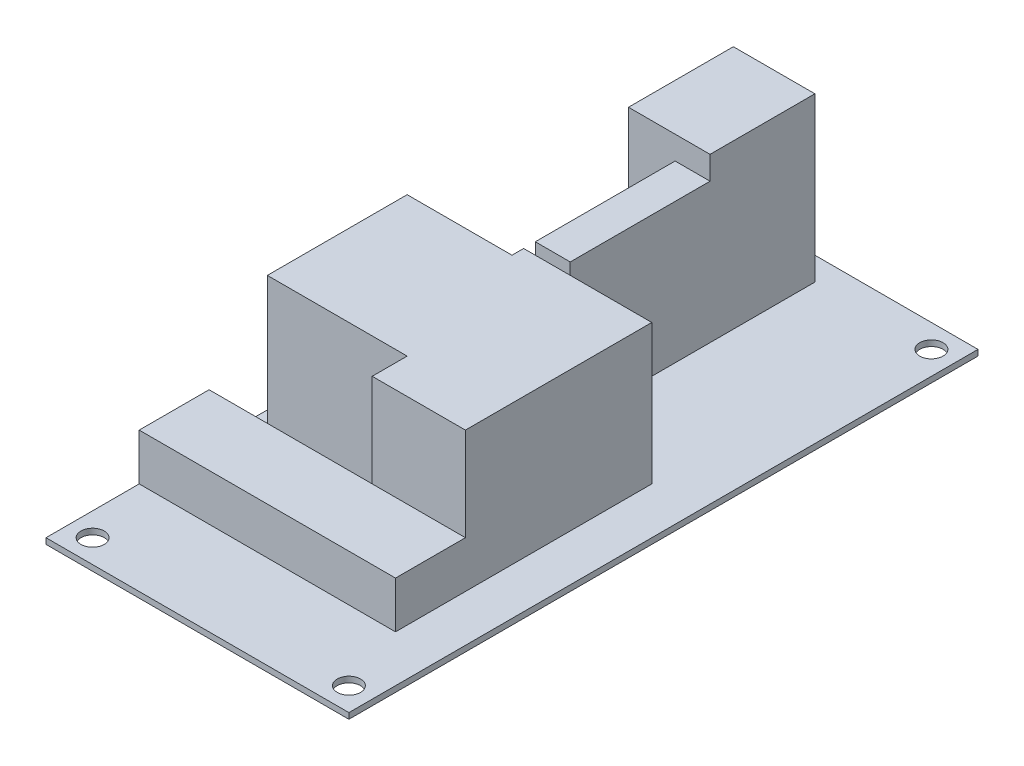
from build123d import *

# Parameters (mm, degrees)
SKETCH1_W           = 41.275
SKETCH1_H           = 85.725
BOSS_EXTRUDE1_DEPTH = 0.79375
SKETCH2_W           = 34.925
SKETCH2_H           = 9.525
BOSS_EXTRUDE2_DEPTH = 6.35
BOSS_EXTRUDE3_DEPTH = 19.05
SKETCH4_W           = 11.1125
SKETCH4_H           = 11.1125
BOSS_EXTRUDE4_DEPTH = 6.35
SKETCH5_R           = 2.38125
BOSS_EXTRUDE5_DEPTH = 3.175
SKETCH6_W           = 4.7625
SKETCH6_H           = 19.05
BOSS_EXTRUDE6_DEPTH = 19.05
SKETCH7_W           = 11.1125
SKETCH7_H           = 14.2875
BOSS_EXTRUDE7_DEPTH = 22.225
SKETCH8_R           = 1.5875
CUT_EXTRUDE1_DEPTH  = 53.507627422


with BuildPart() as part:
    # Sketch1 → Boss-Extrude1 (new body)
    with BuildSketch(Plane(origin=(0, 0, 0), x_dir=(1, 0, 0), z_dir=(0, 1, 0))):
        Rectangle(SKETCH1_W, SKETCH1_H)
    extrude(amount=BOSS_EXTRUDE1_DEPTH)

    # Sketch2 → Boss-Extrude2 (add)
    with BuildSketch(Plane(origin=(0, 0.79375, 0), x_dir=(1, 0, 0), z_dir=(0, 1, 0))):
        with Locations((-3.175, -25.4)):
            Rectangle(SKETCH2_W, SKETCH2_H)
    extrude(amount=BOSS_EXTRUDE2_DEPTH)

    # Sketch3 → Boss-Extrude3 (add)
    with BuildSketch(Plane(origin=(0, 0.79375, 0), x_dir=(1, 0, 0), z_dir=(0, 1, 0))):
        Polygon((14.2875, -20.6375), (14.2875, 4.7625), (-3.175, 4.7625), (-3.175, 3.175), (-17.4625, 3.175), (-17.4625, -15.875), (1.5875, -15.875), (1.5875, -20.6375), align=None)
    extrude(amount=BOSS_EXTRUDE3_DEPTH)

    # Sketch4 → Boss-Extrude4 (add)
    with BuildSketch(Plane(origin=(0, 0.79375, 0), x_dir=(1, 0, 0), z_dir=(0, 1, 0))):
        with Locations((-8.73125, 15.08125)):
            Rectangle(SKETCH4_W, SKETCH4_H)
    extrude(amount=BOSS_EXTRUDE4_DEPTH)

    # Sketch5 → Boss-Extrude5 (add)
    with BuildSketch(Plane(origin=(0, 7.14375, 0), x_dir=(1, 0, 0), z_dir=(0, 1, 0))):
        with Locations((-8.73125, 15.08125)):
            Circle(SKETCH5_R)
    extrude(amount=BOSS_EXTRUDE5_DEPTH)

    # Sketch6 → Boss-Extrude6 (add)
    with BuildSketch(Plane(origin=(0, 0.79375, 0), x_dir=(1, 0, 0), z_dir=(0, 1, 0))):
        with Locations((-0.79375, 15.875)):
            Rectangle(SKETCH6_W, SKETCH6_H)
    extrude(amount=BOSS_EXTRUDE6_DEPTH)

    # Sketch7 → Boss-Extrude7 (add)
    with BuildSketch(Plane(origin=(0, 0.79375, 0), x_dir=(1, 0, 0), z_dir=(0, 1, 0))):
        with Locations((-3.96875, 32.54375)):
            Rectangle(SKETCH7_W, SKETCH7_H)
    extrude(amount=BOSS_EXTRUDE7_DEPTH)

    # Sketch8 → Cut-Extrude1 (cut, through all)
    with BuildSketch(Plane(origin=(0, 0.79375, 0), x_dir=(1, 0, 0), z_dir=(0, 1, 0))):
        with Locations((-17.4625, 39.6875)):
            Circle(SKETCH8_R)
        with Locations((17.4625, 39.6875)):
            Circle(SKETCH8_R)
        with Locations((-17.4625, -39.6875)):
            Circle(SKETCH8_R)
        with Locations((17.4625, -39.6875)):
            Circle(SKETCH8_R)
    extrude(amount=-CUT_EXTRUDE1_DEPTH, mode=Mode.SUBTRACT)


solid = part.part
